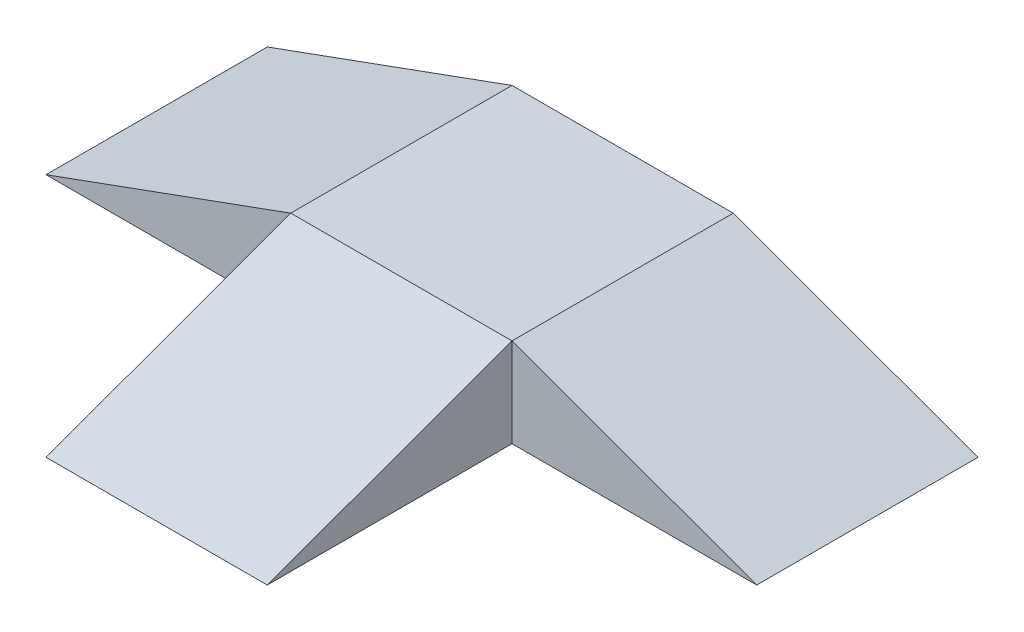
from build123d import *

# Parameters (mm, degrees)
SKETCH1_W           = 350
SKETCH1_H           = 350
BOSS_EXTRUDE1_DEPTH = 140.9
BOSS_EXTRUDE2_DEPTH = 175
BOSS_EXTRUDE3_DEPTH = 175


with BuildPart() as part:
    # Sketch1 → Boss-Extrude1 (new body)
    with BuildSketch(Plane(origin=(0, 0, 0), x_dir=(1, 0, 0), z_dir=(0, 1, 0))):
        Rectangle(SKETCH1_W, SKETCH1_H)
    extrude(amount=BOSS_EXTRUDE1_DEPTH)

    # Sketch2 → Boss-Extrude2 (add, symmetric)
    with BuildSketch(Plane(origin=(0, 0, 0), x_dir=(0, 0, -1), z_dir=(1, 0, 0))):
        Polygon((-175, 140.9), (-175, 0), (-562.157836031, 0), align=None)
    extrude(amount=BOSS_EXTRUDE2_DEPTH, both=True)

    # Sketch3 → Boss-Extrude3 (add, symmetric)
    with BuildSketch(Plane.XY):
        Polygon((-175, 140.9), (-562.157836031, 0), (-175, 0), align=None)
        Polygon((175, 140.9), (175, 0), (562.157836031, 0), align=None)
    extrude(amount=BOSS_EXTRUDE3_DEPTH, both=True)


solid = part.part
